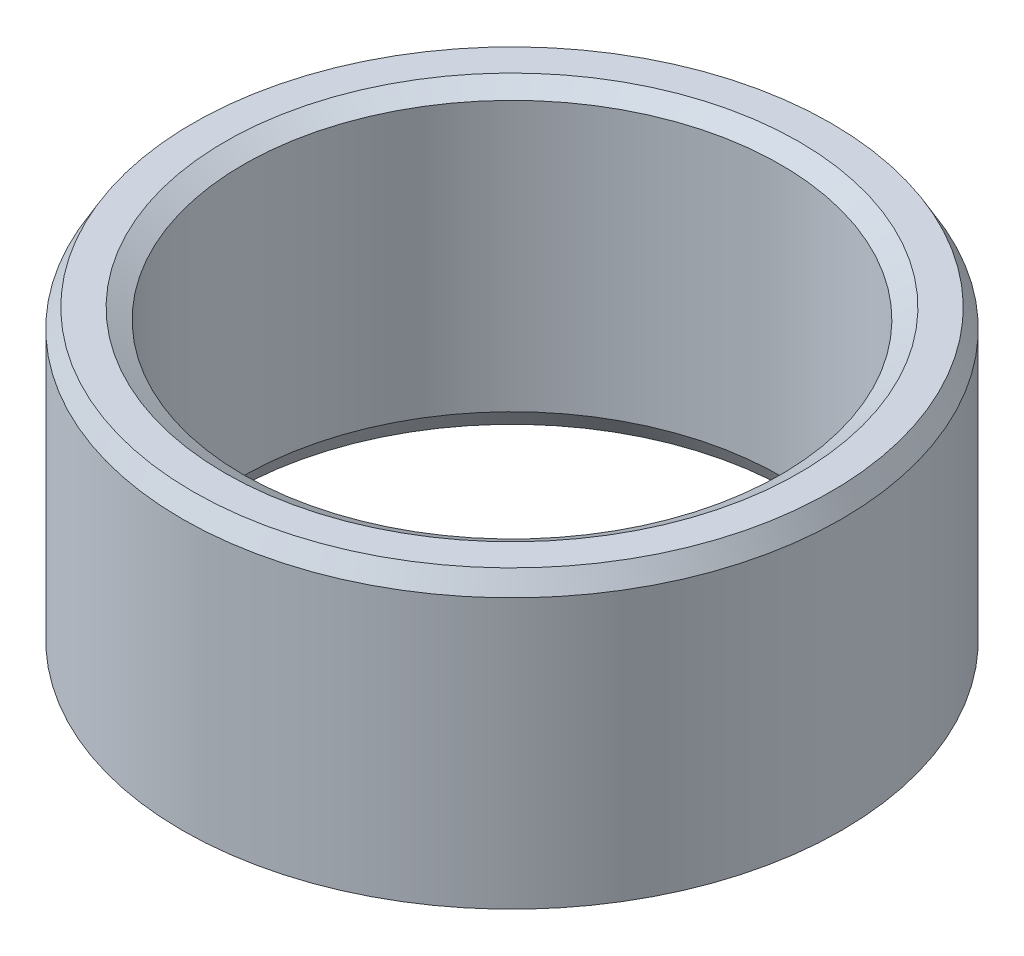
from build123d import *
from OCP.BRepFilletAPI import BRepFilletAPI_MakeChamfer

# Parameters (mm, degrees)
SKETCH1_R           = 22.5
BOSS_EXTRUDE1_DEPTH = 20.38486233
SKETCH2_R           = 18.332222423
CUT_EXTRUDE1_DEPTH  = 38.789451071
CHAMFER1_SIZE       = 1.256377244
CHAMFER1_SIZE2      = 0.72536974


with BuildPart() as part:
    # Sketch1 → Boss-Extrude1 (new body)
    with BuildSketch(Plane(origin=(0, 0, 0), x_dir=(1, 0, 0), z_dir=(0, 1, 0))):
        Circle(SKETCH1_R)
    extrude(amount=BOSS_EXTRUDE1_DEPTH)

    # Sketch2 → Cut-Extrude1 (cut, through all)
    with BuildSketch(Plane(origin=(0, 0, 0), x_dir=(1, 0, 0), z_dir=(0, 1, 0))):
        Circle(SKETCH2_R)
    extrude(amount=CUT_EXTRUDE1_DEPTH, mode=Mode.SUBTRACT)

    # Chamfer1: one chamfer whose edges measure the first distance from different faces: ONE call of the kernel's chamfer builder (chamfer() names one face for all edges)
    chamfer1_edges_1 = [part.edges().sort_by_distance(p)[0] for p in [
        (-18.332222423, 20.38486233, 0),
    ]]
    chamfer1_side_1 = [part.faces().sort_by_distance(p)[0] for p in [
        (-21.863603897, 20.38486233, 0),
    ]]
    chamfer1_edges_2 = [part.edges().sort_by_distance(p)[0] for p in [
        (-18.332222423, 0, 0),
    ]]
    chamfer1_side_2 = [part.faces().sort_by_distance(p)[0] for p in [
        (-18.332222423, 10.192431165, 0),
    ]]
    chamfer1_edges_3 = [part.edges().sort_by_distance(p)[0] for p in [
        (-22.5, 0, 0),
    ]]
    chamfer1_side_3 = [part.faces().sort_by_distance(p)[0] for p in [
        (-21.863603897, 0, 0),
    ]]
    chamfer1_edges_4 = [part.edges().sort_by_distance(p)[0] for p in [
        (-22.5, 20.38486233, 0),
    ]]
    chamfer1_side_4 = [part.faces().sort_by_distance(p)[0] for p in [
        (-22.5, 10.192431165, 0),
    ]]
    chamfer1 = BRepFilletAPI_MakeChamfer(part.part.solid().wrapped)
    for e in chamfer1_edges_1:
        chamfer1.Add(CHAMFER1_SIZE, CHAMFER1_SIZE2, e.wrapped, chamfer1_side_1[0].wrapped)  # the first distance lies on this face
    for e in chamfer1_edges_2:
        chamfer1.Add(CHAMFER1_SIZE, CHAMFER1_SIZE2, e.wrapped, chamfer1_side_2[0].wrapped)  # the first distance lies on this face
    for e in chamfer1_edges_3:
        chamfer1.Add(CHAMFER1_SIZE, CHAMFER1_SIZE2, e.wrapped, chamfer1_side_3[0].wrapped)  # the first distance lies on this face
    for e in chamfer1_edges_4:
        chamfer1.Add(CHAMFER1_SIZE, CHAMFER1_SIZE2, e.wrapped, chamfer1_side_4[0].wrapped)  # the first distance lies on this face
    add(Compound.cast(chamfer1.Shape()), mode=Mode.REPLACE)


solid = part.part
